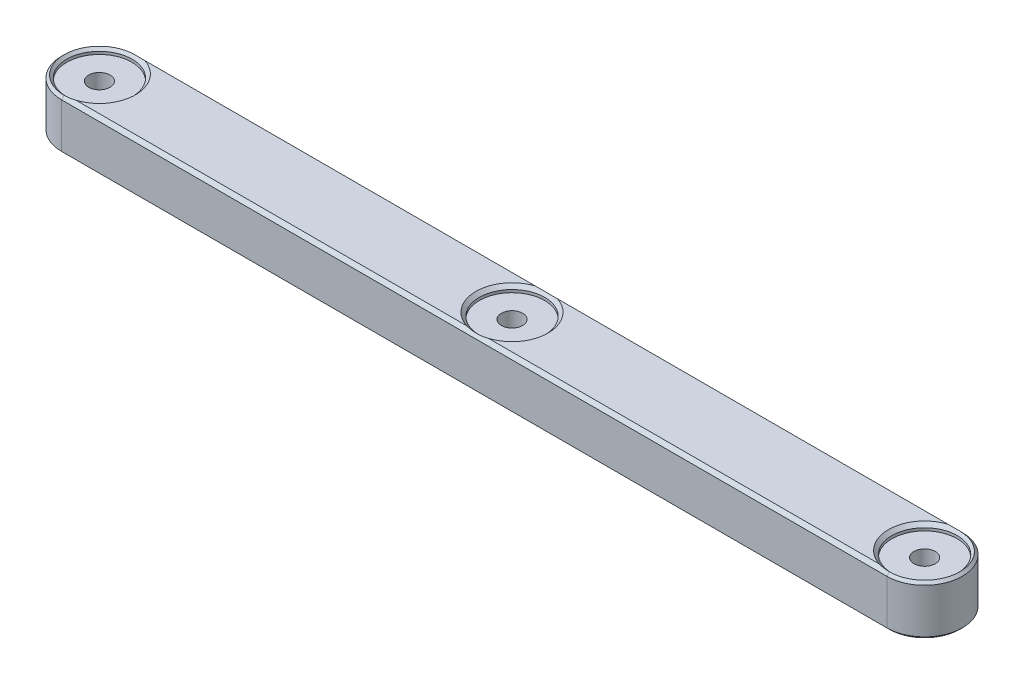
from build123d import *

# Parameters (mm, degrees)
SKETCH1_R           = 3.1
BOSS_EXTRUDE1_DEPTH = 15
SKETCH2_R           = 9.5
CUT_EXTRUDE1_DEPTH  = 1.8
CHAMFER2_SIZE       = 1


with BuildPart() as part:
    # Sketch1 → Boss-Extrude1 (new body)
    with BuildSketch(Plane(origin=(0, 0, 0), x_dir=(1, 0, 0), z_dir=(0, 1, 0))):
        with BuildLine():
            Line((-120, 11), (120, 11))
            ThreePointArc((120, 11), (131, 0), (120, -11))
            Line((120, -11), (-120, -11))
            ThreePointArc((-120, -11), (-131, 0), (-120, 11))
        make_face()
        with Locations(Location((-120, 0, 0), (0, 0, 270))):
            Circle(SKETCH1_R, mode=Mode.SUBTRACT)
        with Locations(Location((120, 0, 0), (0, 0, 270))):
            Circle(SKETCH1_R, mode=Mode.SUBTRACT)
        with Locations(Location((0, 0, 0), (0, 0, 270))):
            Circle(SKETCH1_R, mode=Mode.SUBTRACT)
    extrude(amount=BOSS_EXTRUDE1_DEPTH)

    # Sketch2 → Cut-Extrude1 (cut)
    with BuildSketch(Plane(origin=(0, 15, 0), x_dir=(1, 0, 0), z_dir=(0, 1, 0))):
        with Locations(Location((120, 0, 0), (0, 0, 270))):
            Circle(SKETCH2_R)
        with Locations(Location((0, 0, 0), (0, 0, 270))):
            Circle(SKETCH2_R)
        with Locations(Location((-120, 0, 0), (0, 0, 270))):
            Circle(SKETCH2_R)
    cut_extrude1 = extrude(amount=-CUT_EXTRUDE1_DEPTH, mode=Mode.SUBTRACT)

    # Chamfer2
    chamfer2_edges = [part.edges().sort_by_distance(p)[0] for p in [
        (131, 15, 0),
        (0, 15, -11),
        (-131, 15, 0),
        (0, 0, -11),
        (131, 0, 0),
        (0, 0, 11),
        (-131, 0, 0),
        (0, 15, 11),
    ]]
    chamfer(chamfer2_edges, length=CHAMFER2_SIZE)

    # Mirror1: Cut-Extrude1 across plane
    add(cut_extrude1.mirror(Plane.ZX.offset(7.5)), mode=Mode.SUBTRACT)

    # Chamfer1: read off the stored shape, not the designer's step
    # Chamfer1: loft between two sections, ruled curve by curve
    chamfer1_from = [
        Edge.make_three_point_arc((120, 1, 9.5), (110.5, 1, 0), (120, 1, -9.5)),
        Edge.make_three_point_arc((120, 1, -9.5), (129.5, 1, 0), (120, 1, 9.5)),
    ]
    chamfer1_to = [
        Edge.make_three_point_arc((120, 0, 10.5), (109.5, 0, 0), (120, 0, -10.5)),
        Edge.make_three_point_arc((120, 0, -10.5), (130.5, 0, 0), (120, 0, 10.5)),
    ]
    chamfer1 = Solid(Shell([*[Face.make_surface_from_curves(chamfer1_from[k], chamfer1_to[k]) for k in range(2)], Face(Wire(chamfer1_from)), Face(Wire(chamfer1_to))]))
    add(chamfer1, mode=Mode.SUBTRACT)

    # Chamfer1 2: loft between two sections, ruled curve by curve
    chamfer1_2_from = [
        Edge.make_three_point_arc((2.896651441, 1, -9.047619048), (9.047619048, 1, 2.896651441), (-2.896651441, 1, 9.047619048)),
        Edge.make_three_point_arc((-2.896651441, 1, 9.047619048), (-9.047619048, 1, -2.896651441), (2.896651441, 1, -9.047619048)),
    ]
    chamfer1_2_to = [
        Edge.make_three_point_arc((3.201562119, 0, -10), (10, 0, 3.201562119), (-3.201562119, 0, 10)),
        Edge.make_three_point_arc((-3.201562119, 0, 10), (-10, 0, -3.201562119), (3.201562119, 0, -10)),
    ]
    chamfer1_2 = Solid(Shell([*[Face.make_surface_from_curves(chamfer1_2_from[k], chamfer1_2_to[k]) for k in range(2)], Face(Wire(chamfer1_2_from)), Face(Wire(chamfer1_2_to))]))
    add(chamfer1_2, mode=Mode.SUBTRACT)

    # Chamfer1 3: loft between two sections, ruled curve by curve
    chamfer1_3_from = [
        Edge.make_three_point_arc((-120, 1, 9.5), (-129.5, 1, 0), (-120, 1, -9.5)),
        Edge.make_three_point_arc((-120, 1, -9.5), (-110.5, 1, 0), (-120, 1, 9.5)),
    ]
    chamfer1_3_to = [
        Edge.make_three_point_arc((-120, 0, 10.5), (-130.5, 0, 0), (-120, 0, -10.5)),
        Edge.make_three_point_arc((-120, 0, -10.5), (-109.5, 0, 0), (-120, 0, 10.5)),
    ]
    chamfer1_3 = Solid(Shell([*[Face.make_surface_from_curves(chamfer1_3_from[k], chamfer1_3_to[k]) for k in range(2)], Face(Wire(chamfer1_3_from)), Face(Wire(chamfer1_3_to))]))
    add(chamfer1_3, mode=Mode.SUBTRACT)

    # Chamfer1 4: loft between two sections, ruled curve by curve
    chamfer1_4_from = [
        Edge.make_three_point_arc((120, 14, 9.5), (129.5, 14, 0), (120, 14, -9.5)),
        Edge.make_three_point_arc((120, 14, -9.5), (110.5, 14, 0), (120, 14, 9.5)),
    ]
    chamfer1_4_to = [
        Edge.make_three_point_arc((120, 15, 10.5), (130.5, 15, 0), (120, 15, -10.5)),
        Edge.make_three_point_arc((120, 15, -10.5), (109.5, 15, 0), (120, 15, 10.5)),
    ]
    chamfer1_4 = Solid(Shell([*[Face.make_surface_from_curves(chamfer1_4_from[k], chamfer1_4_to[k]) for k in range(2)], Face(Wire(chamfer1_4_from)), Face(Wire(chamfer1_4_to))]))
    add(chamfer1_4, mode=Mode.SUBTRACT)

    # Chamfer1 5: loft between two sections, ruled curve by curve
    chamfer1_5_from = [
        Edge.make_three_point_arc((0, 14, 9.5), (9.5, 14, 0), (0, 14, -9.5)),
        Edge.make_three_point_arc((0, 14, -9.5), (-9.5, 14, 0), (0, 14, 9.5)),
    ]
    chamfer1_5_to = [
        Edge.make_three_point_arc((0, 15, 10.5), (10.5, 15, 0), (0, 15, -10.5)),
        Edge.make_three_point_arc((0, 15, -10.5), (-10.5, 15, 0), (0, 15, 10.5)),
    ]
    chamfer1_5 = Solid(Shell([*[Face.make_surface_from_curves(chamfer1_5_from[k], chamfer1_5_to[k]) for k in range(2)], Face(Wire(chamfer1_5_from)), Face(Wire(chamfer1_5_to))]))
    add(chamfer1_5, mode=Mode.SUBTRACT)

    # Chamfer1 6: loft between two sections, ruled curve by curve
    chamfer1_6_from = [
        Edge.make_three_point_arc((-120, 14, 9.5), (-110.5, 14, 0), (-120, 14, -9.5)),
        Edge.make_three_point_arc((-120, 14, -9.5), (-129.5, 14, 0), (-120, 14, 9.5)),
    ]
    chamfer1_6_to = [
        Edge.make_three_point_arc((-120, 15, 10.5), (-109.5, 15, 0), (-120, 15, -10.5)),
        Edge.make_three_point_arc((-120, 15, -10.5), (-130.5, 15, 0), (-120, 15, 10.5)),
    ]
    chamfer1_6 = Solid(Shell([*[Face.make_surface_from_curves(chamfer1_6_from[k], chamfer1_6_to[k]) for k in range(2)], Face(Wire(chamfer1_6_from)), Face(Wire(chamfer1_6_to))]))
    add(chamfer1_6, mode=Mode.SUBTRACT)


solid = part.part
